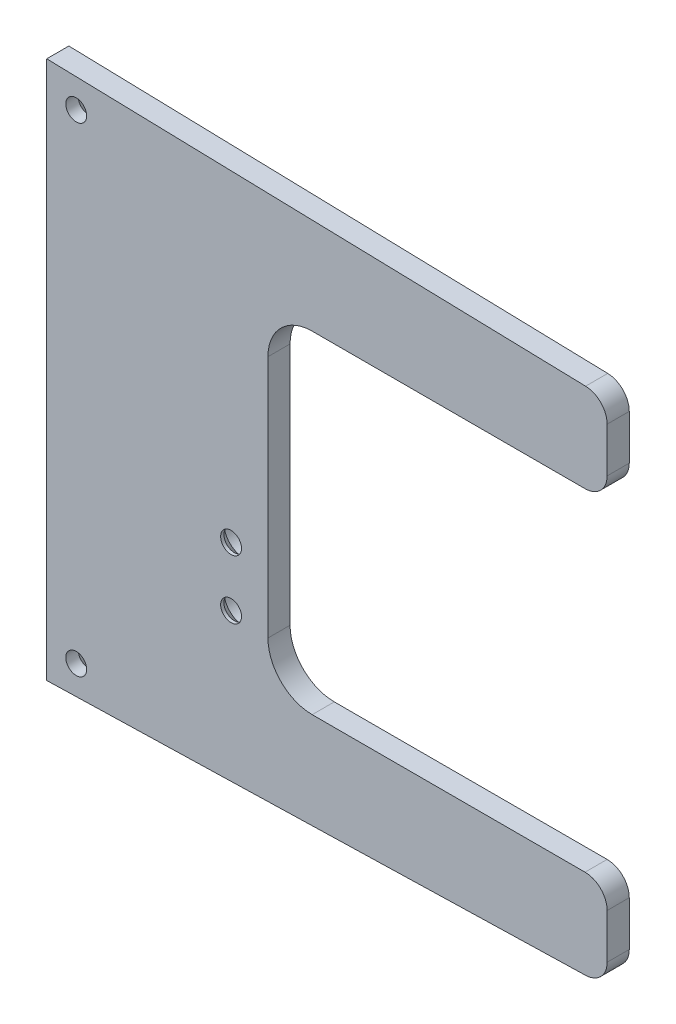
from build123d import *
from build123d.topology import SkipClean

# Parameters (mm, degrees)
SKETCH1_W                                       = 95.25
SKETCH1_H                                       = 231.8385
EXTRUDE1_DEPTH                                  = 9.525
CSK_FOR_M8_FLAT_HEAD_MACHINE_SCREW1_AT_2_COUNT  = 2
CSK_FOR_M8_FLAT_HEAD_MACHINE_SCREW1_AT_2_PITCH  = 25.4
CSK_FOR_M8_FLAT_HEAD_MACHINE_SCREW2_D           = 9
CSK_FOR_M8_FLAT_HEAD_MACHINE_SCREW2_CSINK_D     = 17.3
CSK_FOR_M8_FLAT_HEAD_MACHINE_SCREW2_CSINK_ANGLE = 90
CUT_EXTRUDE1_REACH                              = 127.683
BOSS_EXTRUDE1_DEPTH                             = 9.525
FILLET1_R                                       = 9.525
FILLET2_R                                       = 19.05
BODY_MOVE_COPY1_2_OUTLINE_R                     = 4.5
BODY_MOVE_COPY1_2_DEPTH                         = 9.525
BODY_MOVE_COPY1_START                           = -9.525
BODY_MOVE_COPY1_3_OUTLINE_R                     = 4.5
BODY_MOVE_COPY1_3_OUTLINE_R_2                   = 8.65
BODY_MOVE_COPY1_3_DEPTH                         = 9.525
BODY_MOVE_COPY1_START_2                         = -5.5626001
BODY_MOVE_COPY1_4_OUTLINE_R                     = 8.65
BODY_MOVE_COPY1_4_OUTLINE_R_2                   = 4.5
BODY_MOVE_COPY1_4_DEPTH                         = 5.5626001


with BuildPart() as part:
    # Sketch1 → Extrude1 (new body)
    with BuildSketch(Plane.XY):
        Rectangle(SKETCH1_W, SKETCH1_H)
    extrude(amount=EXTRUDE1_DEPTH)

    # Sketch4 → CSK for M8 Flat Head Machine Screw1 (revolve, cut)
    with BuildSketch(Plane(origin=(31.75, -50.15865, 9.525), x_dir=(0, -1, 0), z_dir=(1, 0, 0))):
        Polygon((0, 0), (0, 9.525), (4.5, 9.525), (4.5, 8.1124), (8.65, 3.9624), (8.65, 0), align=None)
    csk_for_m8_flat_head_machine_screw1 = revolve(axis=Axis((31.75, -50.15865, 15.875), (0, 0, -1)), mode=Mode.SUBTRACT)

    # CSK for M8 Flat Head Machine Screw1 at 2: CSK for M8 Flat Head Machine Screw1 ×2
    with Locations(*[(0, i * CSK_FOR_M8_FLAT_HEAD_MACHINE_SCREW1_AT_2_PITCH, 0) for i in range(1, CSK_FOR_M8_FLAT_HEAD_MACHINE_SCREW1_AT_2_COUNT)]):
        add(csk_for_m8_flat_head_machine_screw1, mode=Mode.SUBTRACT)

    # CSK for M8 Flat Head Machine Screw2 (through all)
    with Locations(Plane.XY.offset(9.525)):
        with Locations((-34.925, 103.21925), (-34.925, -103.21925)):
            CounterSinkHole(CSK_FOR_M8_FLAT_HEAD_MACHINE_SCREW2_D / 2, CSK_FOR_M8_FLAT_HEAD_MACHINE_SCREW2_CSINK_D / 2, counter_sink_angle=CSK_FOR_M8_FLAT_HEAD_MACHINE_SCREW2_CSINK_ANGLE)

    # Sketch11 → Cut-Extrude1 (cut, up to next)
    with BuildSketch(Plane.XY.offset(9.525), mode=Mode.PRIVATE) as cut_extrude1_sk1:
        Polygon((-47.625, 115.91925), (47.625, 113.425040971), (47.625, 115.91925), align=None)
    cut_extrude1_tool1 = extrude(cut_extrude1_sk1.sketch, amount=-CUT_EXTRUDE1_REACH, mode=Mode.PRIVATE) & part.part
    # Sketch11 → Cut-Extrude1 (cut, up to next)
    with BuildSketch(Plane.XY.offset(9.525), mode=Mode.PRIVATE) as cut_extrude1_sk2:
        Polygon((-47.625, -115.91925), (47.625, -115.91925), (47.625, -113.425040971), align=None)
    cut_extrude1_tool2 = extrude(cut_extrude1_sk2.sketch, amount=-CUT_EXTRUDE1_REACH, mode=Mode.PRIVATE) & part.part
    add(cut_extrude1_tool1.solids().sort_by_distance((15.875, 115.087847, 9.525))[0], mode=Mode.SUBTRACT)
    add(cut_extrude1_tool2.solids().sort_by_distance((15.875, -115.087847, 9.525))[0], mode=Mode.SUBTRACT)

    # Sketch12 → Boss-Extrude1 (add)
    with BuildSketch(Plane.XY.offset(9.525)):
        Polygon((47.625, 113.425040971), (193.675, 109.600587125), (193.675, 71.500587125), (47.625, 71.500587125), align=None)
        Polygon((47.625, -71.500587125), (193.675, -71.500587125), (193.675, -109.600587125), (47.625, -113.425040971), align=None)
    extrude(amount=-BOSS_EXTRUDE1_DEPTH)

    # Fillet1
    fillet1_edges = [part.edges().sort_by_distance(p)[0] for p in [
        (193.675, 109.600587125, 4.7625),
        (193.675, 71.500587125, 4.7625),
        (193.675, -71.500587125, 4.7625),
        (193.675, -109.600587125, 4.7625),
    ]]
    fillet(fillet1_edges, radius=FILLET1_R)

    # Fillet2
    fillet2_edges = [part.edges().sort_by_distance(p)[0] for p in [
        (47.625, 71.500587125, 4.7625),
        (47.625, -71.500587125, 4.7625),
    ]]
    fillet(fillet2_edges, radius=FILLET2_R)

    # Body-Move/Copy1: read off the stored shape, not the designer's step
    # Body-Move/Copy1 outline → Body-Move/Copy1 (revolve)
    with SkipClean():  # the faces are left unmerged after this step: merging them gives an invalid solid
        with BuildSketch(Plane(origin=(31.75, -50.15865, 0), x_dir=(1, 0, 0), z_dir=(0, -1, 0))):
            Polygon((4.5, -1.4126), (8.65, -5.5626), (8.65, 0), (4.5, 0), align=None)
        revolve(axis=Axis((31.75, -50.15865, 0), (0, 0, 1)))

    # Body-Move_Copy1 2 outline → Body-Move_Copy1 2 (cut)
    with BuildSketch(Plane.XY):
        with BuildLine():
            Line((-47.625, 115.91925), (-47.625, -115.91925))
            Line((-47.625, -115.91925), (184.399335433, -109.84347895))
            ThreePointArc((184.399335433, -109.84347895), (190.972776011, -106.96819706), (193.675, -100.32174293))
            Line((193.675, -100.32174293), (193.675, -81.025587125))
            ThreePointArc((193.675, -81.025587125), (190.88519209, -74.290395035), (184.15, -71.500587125))
            Line((184.15, -71.500587125), (66.675, -71.500587125))
            ThreePointArc((66.675, -71.500587125), (53.204615818, -65.920971307), (47.625, -52.450587125))
            Line((47.625, -52.450587125), (47.625, 52.450587125))
            ThreePointArc((47.625, 52.450587125), (53.204615818, 65.920971307), (66.675, 71.500587125))
            Line((66.675, 71.500587125), (184.15, 71.500587125))
            ThreePointArc((184.15, 71.500587125), (190.88519209, 74.290395035), (193.675, 81.025587125))
            Line((193.675, 81.025587125), (193.675, 100.32174293))
            ThreePointArc((193.675, 100.32174293), (190.972776011, 106.96819706), (184.399335433, 109.84347895))
            Line((184.399335433, 109.84347895), (-47.625, 115.91925))
        make_face()
        with Locations((-34.925, -103.21925)):
            Circle(BODY_MOVE_COPY1_2_OUTLINE_R, mode=Mode.SUBTRACT)
        with Locations((-34.925, 103.21925)):
            Circle(BODY_MOVE_COPY1_2_OUTLINE_R, mode=Mode.SUBTRACT)
        with Locations((31.75, -50.15865)):
            Circle(BODY_MOVE_COPY1_2_OUTLINE_R, mode=Mode.SUBTRACT)
        with Locations((31.75, -24.75865)):
            Circle(BODY_MOVE_COPY1_2_OUTLINE_R, mode=Mode.SUBTRACT)
    extrude(amount=BODY_MOVE_COPY1_2_DEPTH, mode=Mode.SUBTRACT)

    # Body-Move_Copy1 3 outline → Body-Move_Copy1 3 (add)
    with BuildSketch(Plane.XY.offset(BODY_MOVE_COPY1_START)):
        with BuildLine():
            Line((-47.625, 115.91925), (-47.625, -115.91925))
            Line((-47.625, -115.91925), (184.399335433, -109.84347895))
            ThreePointArc((184.399335433, -109.84347895), (190.972776011, -106.96819706), (193.675, -100.32174293))
            Line((193.675, -100.32174293), (193.675, -81.025587125))
            ThreePointArc((193.675, -81.025587125), (190.88519209, -74.290395035), (184.15, -71.500587125))
            Line((184.15, -71.500587125), (66.675, -71.500587125))
            ThreePointArc((66.675, -71.500587125), (53.204615818, -65.920971307), (47.625, -52.450587125))
            Line((47.625, -52.450587125), (47.625, 52.450587125))
            ThreePointArc((47.625, 52.450587125), (53.204615818, 65.920971307), (66.675, 71.500587125))
            Line((66.675, 71.500587125), (184.15, 71.500587125))
            ThreePointArc((184.15, 71.500587125), (190.88519209, 74.290395035), (193.675, 81.025587125))
            Line((193.675, 81.025587125), (193.675, 100.32174293))
            ThreePointArc((193.675, 100.32174293), (190.972776011, 106.96819706), (184.399335433, 109.84347895))
            Line((184.399335433, 109.84347895), (-47.625, 115.91925))
        make_face()
        with Locations((-34.925, -103.21925)):
            Circle(BODY_MOVE_COPY1_3_OUTLINE_R, mode=Mode.SUBTRACT)
        with Locations((31.75, -50.15865)):
            Circle(BODY_MOVE_COPY1_3_OUTLINE_R_2, mode=Mode.SUBTRACT)
        with Locations((31.75, -24.75865)):
            Circle(BODY_MOVE_COPY1_3_OUTLINE_R_2, mode=Mode.SUBTRACT)
        with Locations((-34.925, 103.21925)):
            Circle(BODY_MOVE_COPY1_3_OUTLINE_R, mode=Mode.SUBTRACT)
    extrude(amount=BODY_MOVE_COPY1_3_DEPTH)

    # Body-Move_Copy1 4 outline → Body-Move_Copy1 4 (add)
    with BuildSketch(Plane.XY.offset(BODY_MOVE_COPY1_START_2)):
        with Locations((31.75, -24.75865)):
            Circle(BODY_MOVE_COPY1_4_OUTLINE_R)
        with Locations((31.75, -24.75865)):
            Circle(BODY_MOVE_COPY1_4_OUTLINE_R_2, mode=Mode.SUBTRACT)
    extrude(amount=BODY_MOVE_COPY1_4_DEPTH)

    # Body-Move_Copy1 5: loft between two sections, ruled curve by curve
    body_move_copy1_5_from = [
        Edge.make_three_point_arc((36.25, -24.75865, -1.4126), (31.75, -29.25865, -1.4126), (27.25, -24.75865, -1.4126)),
        Edge.make_three_point_arc((27.25, -24.75865, -1.4126), (31.75, -20.25865, -1.4126), (36.25, -24.75865, -1.4126)),
    ]
    body_move_copy1_5_to = [
        Edge.make_three_point_arc((40.4, -24.75865, -5.5626), (31.75, -33.40865, -5.5626), (23.1, -24.75865, -5.5626)),
        Edge.make_three_point_arc((23.1, -24.75865, -5.5626), (31.75, -16.10865, -5.5626), (40.4, -24.75865, -5.5626)),
    ]
    body_move_copy1_5 = Solid(Shell([*[Face.make_surface_from_curves(body_move_copy1_5_from[k], body_move_copy1_5_to[k]) for k in range(2)], Face(Wire(body_move_copy1_5_from)), Face(Wire(body_move_copy1_5_to))]))
    add(body_move_copy1_5, mode=Mode.SUBTRACT)

    # Body-Move_Copy1 6: loft between two sections, ruled curve by curve
    body_move_copy1_6_from = [
        Edge.make_three_point_arc((-30.425, -103.21925, -5.375), (-34.925, -107.71925, -5.375), (-39.425, -103.21925, -5.375)),
        Edge.make_three_point_arc((-39.425, -103.21925, -5.375), (-34.925, -98.71925, -5.375), (-30.425, -103.21925, -5.375)),
    ]
    body_move_copy1_6_to = [
        Edge.make_three_point_arc((-26.275, -103.21925, -9.525), (-34.925, -111.86925, -9.525), (-43.575, -103.21925, -9.525)),
        Edge.make_three_point_arc((-43.575, -103.21925, -9.525), (-34.925, -94.56925, -9.525), (-26.275, -103.21925, -9.525)),
    ]
    body_move_copy1_6 = Solid(Shell([*[Face.make_surface_from_curves(body_move_copy1_6_from[k], body_move_copy1_6_to[k]) for k in range(2)], Face(Wire(body_move_copy1_6_from)), Face(Wire(body_move_copy1_6_to))]))
    add(body_move_copy1_6, mode=Mode.SUBTRACT)

    # Body-Move_Copy1 7: loft between two sections, ruled curve by curve
    body_move_copy1_7_from = [
        Edge.make_three_point_arc((-30.425, 103.21925, -5.375), (-34.925, 98.71925, -5.375), (-39.425, 103.21925, -5.375)),
        Edge.make_three_point_arc((-39.425, 103.21925, -5.375), (-34.925, 107.71925, -5.375), (-30.425, 103.21925, -5.375)),
    ]
    body_move_copy1_7_to = [
        Edge.make_three_point_arc((-26.275, 103.21925, -9.525), (-34.925, 94.56925, -9.525), (-43.575, 103.21925, -9.525)),
        Edge.make_three_point_arc((-43.575, 103.21925, -9.525), (-34.925, 111.86925, -9.525), (-26.275, 103.21925, -9.525)),
    ]
    body_move_copy1_7 = Solid(Shell([*[Face.make_surface_from_curves(body_move_copy1_7_from[k], body_move_copy1_7_to[k]) for k in range(2)], Face(Wire(body_move_copy1_7_from)), Face(Wire(body_move_copy1_7_to))]))
    add(body_move_copy1_7, mode=Mode.SUBTRACT)


solid = part.part
